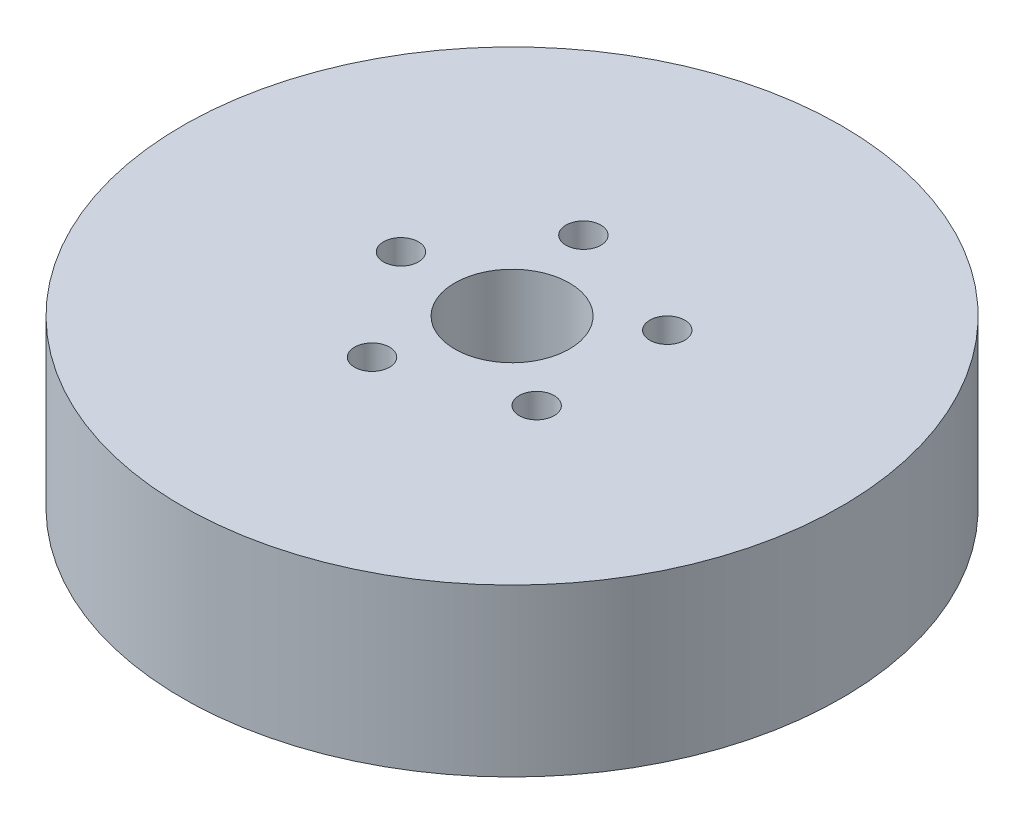
from build123d import *

# Parameters (mm, degrees)
SKETCH1_R           = 57.5
BOSS_EXTRUDE1_DEPTH = 29
SKETCH2_R           = 10
CUT_EXTRUDE1_DEPTH  = 87.333655083
SKETCH3_R           = 3.050067487
CUT_EXTRUDE2_DEPTH  = 18.812661923
CIRPATTERN1_COUNT   = 5


with BuildPart() as part:
    # Sketch1 → Boss-Extrude1 (new body)
    with BuildSketch(Plane(origin=(0, 0, 0), x_dir=(1, 0, 0), z_dir=(0, 1, 0))):
        Circle(SKETCH1_R)
    extrude(amount=BOSS_EXTRUDE1_DEPTH)

    # Sketch2 → Cut-Extrude1 (cut, through all)
    with BuildSketch(Plane(origin=(0, 0, 0), x_dir=(1, 0, 0), z_dir=(0, 1, 0))):
        Circle(SKETCH2_R)
    extrude(amount=CUT_EXTRUDE1_DEPTH, mode=Mode.SUBTRACT)

    # Sketch3 → Cut-Extrude2 (cut)
    with BuildSketch(Plane(origin=(0, 29, 0), x_dir=(1, 0, 0), z_dir=(0, 1, 0))):
        with Locations((-19.38683408, 0)):
            Circle(SKETCH3_R)
    cut_extrude2 = extrude(amount=-CUT_EXTRUDE2_DEPTH, mode=Mode.SUBTRACT)

    # CirPattern1: Cut-Extrude2 ×5 about axis
    cirpattern1_axis = Axis((0, 0, 0), (0, 1, 0))
    for i in range(1, CIRPATTERN1_COUNT):
        add(cut_extrude2.rotate(cirpattern1_axis, i * 360 / CIRPATTERN1_COUNT), mode=Mode.SUBTRACT)


solid = part.part
